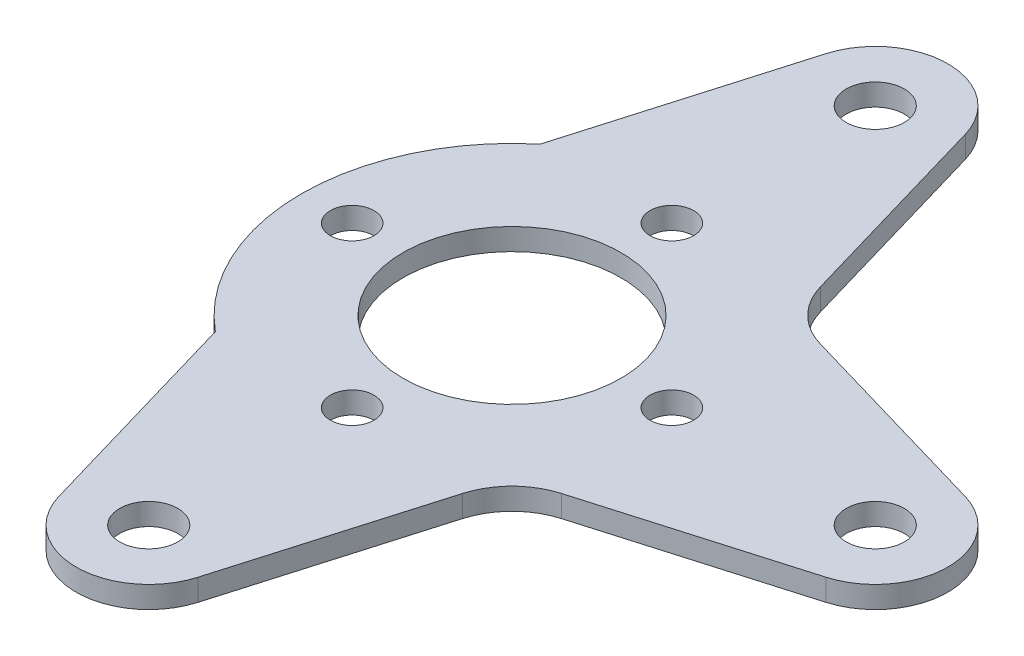
from build123d import *

# Parameters (mm, degrees)
SZKIC1_R                    = 4
SZKIC1_R_2                  = 3
SZKIC1_R_3                  = 15
DODANIE_WYCI_GNI_CIE1_DEPTH = 3


with BuildPart() as part:
    # Szkic1 → Dodanie-wyciągnięcie1 (new body)
    with BuildSketch(Plane(origin=(0, 0, 0), x_dir=(1, 0, 0), z_dir=(0, 1, 0))):
        with BuildLine():
            Line((2.319354839, -24.619354839), (-5.9, -52.8))
            ThreePointArc((-5.9, -52.8), (-15.5, -60), (-25.1, -52.8))
            Line((-25.1, -52.8), (-33.981930233, -22.347667772))
            ThreePointArc((-33.981930233, -22.347667772), (-44.5, 0), (-33.981930233, 22.347667772))
            Line((-33.981930233, 22.347667772), (-25.1, 52.8))
            ThreePointArc((-25.1, 52.8), (-15.5, 60), (-5.9, 52.8))
            Line((-5.9, 52.8), (2.319354839, 24.619354839))
            ThreePointArc((2.319354839, 24.619354839), (4.848287027, 20.348287027), (9.119354839, 17.819354839))
            Line((9.119354839, 17.819354839), (37.3, 9.6))
            ThreePointArc((37.3, 9.6), (44.5, 0), (37.3, -9.6))
            Line((37.3, -9.6), (9.119354839, -17.819354839))
            ThreePointArc((9.119354839, -17.819354839), (4.848287027, -20.348287027), (2.319354839, -24.619354839))
        make_face()
        with Locations((-15.5, -50)):
            Circle(SZKIC1_R, mode=Mode.SUBTRACT)
        with Locations((-15.5, 50)):
            Circle(SZKIC1_R, mode=Mode.SUBTRACT)
        with Locations((-37.5, 0)):
            Circle(SZKIC1_R_2, mode=Mode.SUBTRACT)
        with Locations((-15.5, -22)):
            Circle(SZKIC1_R_2, mode=Mode.SUBTRACT)
        with Locations((6.5, 0)):
            Circle(SZKIC1_R_2, mode=Mode.SUBTRACT)
        with Locations((-15.5, 22)):
            Circle(SZKIC1_R_2, mode=Mode.SUBTRACT)
        with Locations((34.5, 0)):
            Circle(SZKIC1_R, mode=Mode.SUBTRACT)
        with Locations((-15.5, 0)):
            Circle(SZKIC1_R_3, mode=Mode.SUBTRACT)
    extrude(amount=DODANIE_WYCI_GNI_CIE1_DEPTH)


solid = part.part
